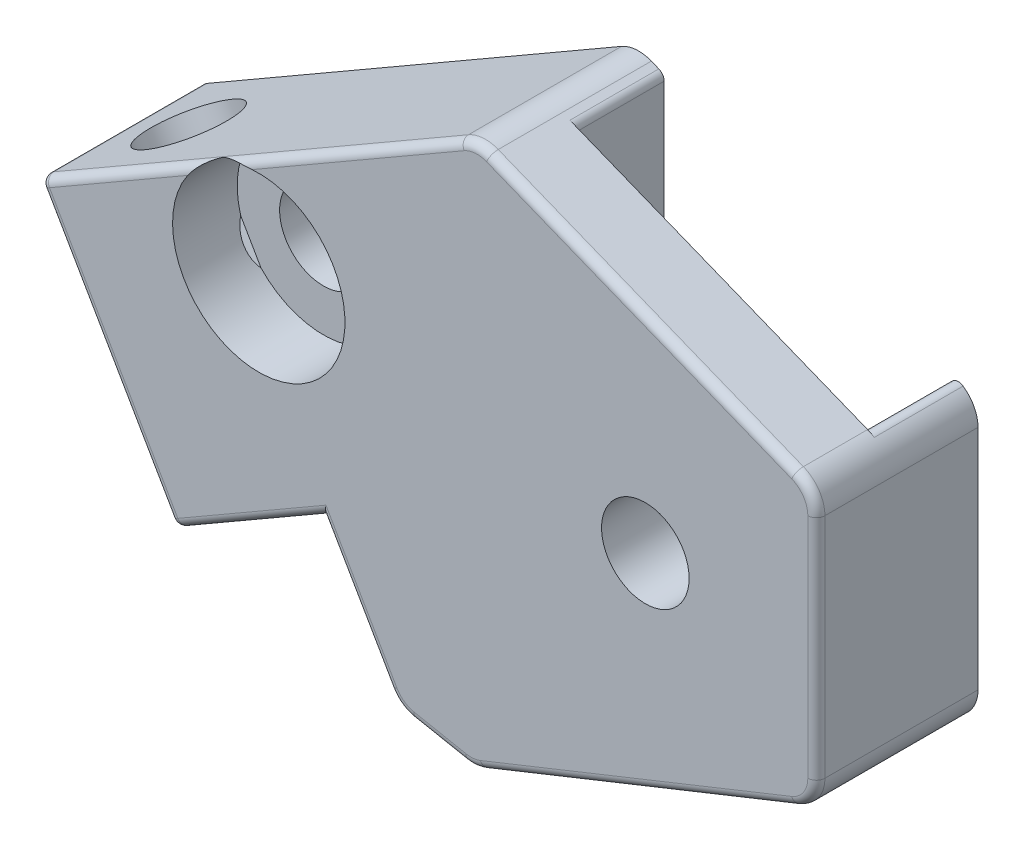
from build123d import *

# Parameters (mm, degrees)
SKETCH1_R           = 2.032
BOSS_EXTRUDE1_DEPTH = 3.375
BOSS_EXTRUDE2_DEPTH = 4.125
SKETCH4_R           = 2.032
BOSS_EXTRUDE3_DEPTH = 7.5
SKETCH5_R           = 2.032
CUT_EXTRUDE1_DEPTH  = 36.913493423
SKETCH6_W           = 7.9375
SKETCH6_H           = 7.5
CUT_EXTRUDE2_DEPTH  = 34.905049671
FILLET1_R           = 1.5875
FILLET2_R           = 0.396875
SKETCH7_R           = 4
CUT_EXTRUDE3_DEPTH  = 3


with BuildPart() as part:
    # Sketch1 → Boss-Extrude1 (new body)
    with BuildSketch(Plane.XY):
        Polygon((5.291666667, -6.35), (-10.583333333, -12.7), (-10.583333333, 12.7), (5.291666667, 6.35), align=None)
        with Locations((-2.645833333, 0)):
            Circle(SKETCH1_R, mode=Mode.SUBTRACT)
    extrude(amount=BOSS_EXTRUDE1_DEPTH)

    # Sketch2 → Boss-Extrude2 (add)
    with BuildSketch(Plane.XY.offset(3.375)):
        Polygon((-10.583333333, 12.7), (-10.583333333, -12.7), (-9.270833333, -12.175), (-9.270833333, 12.175), align=None)
        Polygon((5.291666667, 6.35), (5.291666667, -6.35), (3.979166667, -6.875), (3.979166667, 6.875), align=None)
    extrude(amount=BOSS_EXTRUDE2_DEPTH)

    # Sketch4 → Boss-Extrude3 (add)
    with BuildSketch(Plane(origin=(0, 0, 0), x_dir=(-1, 0, 0), z_dir=(0, 0, -1))):
        Polygon((10.583333333, 12.7), (30.835957968, 1.007141715), (24.485957968, -9.991380913), (10.583333333, -12.7), align=None)
        with Locations((20.584583333, 2.30124)):
            Circle(SKETCH4_R, mode=Mode.SUBTRACT)
    extrude(amount=-BOSS_EXTRUDE3_DEPTH)

    # Sketch5 → Cut-Extrude1 (cut, through all)
    with BuildSketch(Plane(origin=(-8.145094647, 14.107717762, 0), x_dir=(0.8660254037844418, 0.49999999999999467, 0), z_dir=(-0.49999999999999467, 0.8660254037844418, 0))):
        with Locations(Location((-22.451152093, -3.75, 0), (0, 0, 180))):
            Circle(SKETCH5_R)
    extrude(amount=-CUT_EXTRUDE1_DEPTH, mode=Mode.SUBTRACT)

    # Sketch6 → Cut-Extrude2 (cut, through all)
    with BuildSketch(Plane(origin=(-1.795094647, 3.109195134, 0), x_dir=(0.8660254037844418, 0.49999999999999467, 0), z_dir=(-0.49999999999999467, 0.8660254037844418, 0))):
        with Locations((-22.232402093, -3.75)):
            Rectangle(SKETCH6_W, SKETCH6_H)
    extrude(amount=-CUT_EXTRUDE2_DEPTH, mode=Mode.SUBTRACT)

    # Fillet1
    fillet1_edges = [part.edges().sort_by_distance(p)[0] for p in [
        (-14.158893581, -12.003381125, 3.75),
        (-10.583333333, 12.7, 3.75),
        (5.291666667, 6.35, 3.75),
        (5.291666667, -6.35, 3.75),
        (-10.583333333, -12.7, 3.75),
    ]]
    fillet(fillet1_edges, radius=FILLET1_R)

    # Fillet2
    # the kernel refuses this fillet: 0.396875 mm, written as the material it takes off along each edge
    with BuildSketch(Plane(origin=(-30.293816636, 0.861875383, 0.396875), x_dir=(-0.49999999999999467, 0.8660254037844418, 0), z_dir=(0, 0, -1))) as fillet2_piece_1_section:
        Polygon((0, 0), (FILLET2_R, 0), (FILLET2_R, -FILLET2_R), (0, -FILLET2_R), align=None)
    fillet2_piece_1 = extrude(amount=FILLET2_R, mode=Mode.PRIVATE)
    fillet2_piece_1 = fillet2_piece_1 - Plane(origin=(-30.293816636, 0.861875383, 0.396875), x_dir=(0.9659258262890668, -0.25881904510252635, 0), z_dir=(0, 0, -1)) * Sphere(FILLET2_R, mode=Mode.PRIVATE)
    add(fillet2_piece_1, mode=Mode.SUBTRACT)
    with BuildSketch(Plane(origin=(-24.340691636, -9.449239581, 0.396875), x_dir=(0, 0, -1), z_dir=(0.49999999999999467, -0.8660254037844418, 0))) as fillet2_piece_2_section:
        Polygon((0, 0), (FILLET2_R, 0), (FILLET2_R, -FILLET2_R), (0, -FILLET2_R), align=None)
    fillet2_piece_2 = extrude(amount=FILLET2_R, mode=Mode.PRIVATE)
    fillet2_piece_2 = fillet2_piece_2 - Plane(origin=(-24.340691636, -9.449239581, 0.396875), x_dir=(0.6123724356957964, 0.35355339059327046, 0.7071067811865475), z_dir=(0.49999999999999467, -0.8660254037844418, 0)) * Sphere(FILLET2_R, mode=Mode.PRIVATE)
    add(fillet2_piece_2, mode=Mode.SUBTRACT)
    with BuildSketch(Plane(origin=(-9.270833333, 12.175, 3.375), x_dir=(0, -1, 0), z_dir=(0, 0, 1)), Plane(origin=(-9.270833333, -12.175, 3.375), x_dir=(-0.9284766908852634, -0.37139067635409345, 0), z_dir=(0, 0, 1))) as fillet2_piece_3:
        with BuildLine():
            CenterArc((FILLET2_R * 0.677032961427, -FILLET2_R), FILLET2_R, 90, 68.198590514)
            Line((-FILLET2_R * 0.251443729458, -FILLET2_R * 0.628609323646), (0, 0))
            Line((0, 0), (FILLET2_R * 0.677032961427, 0))
        make_face()
    extrude(amount=4.796743641, mode=Mode.SUBTRACT)
    with BuildSketch(Plane(origin=(3.979166667, 6.875, 3.375), x_dir=(0, -1, 0), z_dir=(0, 0, 1))) as fillet2_piece_4:
        with BuildLine():
            CenterArc((0.616849403, 0.396875), FILLET2_R, 145.645994163, 124.354005837)
            Line((0.289202596, 0.620833333), (0.256437915, 0.643229167))
            ThreePointArc((0.256437915, 0.643229167), (0.088984161, 0.329322266), (-0.036848919, 0.014739567))
            Line((-0.036848919, 0.014739567), (0, -0.0396875))
            Line((0, -0.0396875), (0.616849403, -0.0396875))
            Line((0.616849403, -0.0396875), (0.616849403, 0))
        make_face()
    extrude(amount=5.837221089, mode=Mode.SUBTRACT)
    with BuildSketch(Plane(origin=(3.979166667, -6.875, 3.375), x_dir=(0.9064736694503883, 0.4222623433283487, 0), z_dir=(0, 0, 1))) as fillet2_piece_5:
        with BuildLine():
            CenterArc((0.620229012, 0.391572375), FILLET2_R, 155.022498711, 124.354005837)
            Line((0.260472275, 0.559157742), (0.224496601, 0.575916279))
            Line((0.224496601, 0.575916279), (-0.035975674, 0.016758537))
            Line((-0.035975674, 0.016758537), (-0.002198881, -0.039626539))
            ThreePointArc((-0.002198881, -0.039626539), (0.336096623, -0.058398593), (0.691354378, -0.039157237))
            Line((0.691354378, -0.039157237), (0.684888436, 0))
        make_face()
    extrude(amount=5.837221089, mode=Mode.SUBTRACT)
    with BuildSketch(Plane(origin=(-30.835957968, 1.007141715, 0.396875), x_dir=(0.866025403784441, 0.4999999999999959, 0), z_dir=(0, 0, 1)), Plane(origin=(-24.485957968, -9.991380913, 0.396875), x_dir=(-0.4999999999999916, 0.8660254037844436, 0), z_dir=(0, 0, 1))) as fillet2_piece_6:
        with BuildLine():
            CenterArc((FILLET2_R, -FILLET2_R), FILLET2_R, 90, 90)
            Line((0, -FILLET2_R), (0, 0))
            Line((0, 0), (FILLET2_R, 0))
        make_face()
    extrude(amount=8.0953125, mode=Mode.SUBTRACT)
    with BuildSketch(Plane(origin=(-30.637520468, 0.663437883, 0), x_dir=(0.8660254037844414, 0.4999999999999952, 0), z_dir=(0.49999999999999534, -0.8660254037844414, 0))) as fillet2_piece_7:
        with BuildLine():
            CenterArc((FILLET2_R, FILLET2_R), FILLET2_R, 180, 90)
            Line((0, FILLET2_R), (0, 0))
            Line((0, 0), (FILLET2_R, 0))
        make_face()
    extrude(amount=11.90625, mode=Mode.SUBTRACT)
    with BuildSketch(Plane(origin=(-11.250928686, 12.314563643, 0), x_dir=(0.49999999999999467, -0.8660254037844418, 0), z_dir=(-0.8660254037844418, -0.49999999999999467, 0))) as fillet2_piece_8:
        with BuildLine():
            CenterArc((FILLET2_R, FILLET2_R), FILLET2_R, 180, 90)
            Line((0, FILLET2_R), (0, 0))
            Line((0, 0), (FILLET2_R, 0))
        make_face()
    extrude(amount=22.217968856, mode=Mode.SUBTRACT)
    with BuildSketch(Plane(origin=(-17.611881326, -6.022630913, 0), x_dir=(-0.49999999999999467, 0.8660254037844418, 0), z_dir=(-0.8660254037844418, -0.49999999999999467, 0))) as fillet2_piece_9:
        with BuildLine():
            CenterArc((FILLET2_R, -FILLET2_R), FILLET2_R, 90, 90)
            Line((0, -FILLET2_R), (0, 0))
            Line((0, 0), (FILLET2_R, 0))
        make_face()
    extrude(amount=7.540625, mode=Mode.SUBTRACT)
    with BuildSketch(Plane(origin=(-17.611881326, -6.022630913, 0), x_dir=(0.8660254037844417, 0.49999999999999467, 0), z_dir=(0.4999999999999947, -0.8660254037844418, 0))) as fillet2_piece_10:
        with BuildLine():
            CenterArc((FILLET2_R, FILLET2_R), FILLET2_R, 180, 90)
            Line((0, FILLET2_R), (0, 0))
            Line((0, 0), (FILLET2_R, 0))
        make_face()
    extrude(amount=6.182923419, mode=Mode.SUBTRACT)
    with BuildSketch(Plane(origin=(-13.449185577, -12.141652041, 0), x_dir=(0.19123230784154585, 0.9815448051095764, 0), z_dir=(0.9815448051095764, -0.19123230784154585, 0))) as fillet2_piece_11:
        with BuildLine():
            CenterArc((FILLET2_R, FILLET2_R), FILLET2_R, 180, 90)
            Line((0, FILLET2_R), (0, 0))
            Line((0, 0), (FILLET2_R, 0))
        make_face()
    extrude(amount=2.452116689, mode=Mode.SUBTRACT)
    with BuildSketch(Plane(origin=(-9.867595987, 12.413705062, 0), x_dir=(-0.37139067635410367, -0.9284766908852593, 0), z_dir=(0.9284766908852594, -0.3713906763541037, 0))) as fillet2_piece_12:
        with BuildLine():
            CenterArc((FILLET2_R, -FILLET2_R), FILLET2_R, 90, 90)
            Line((0, -FILLET2_R), (0, 0))
            Line((0, 0), (FILLET2_R, 0))
        make_face()
    extrude(amount=15.252235723, mode=Mode.SUBTRACT)
    with BuildSketch(Plane(origin=(5.291666667, 5.275210174, 0), x_dir=(-1, 0, 0), z_dir=(0, -1, 0))) as fillet2_piece_13:
        with BuildLine():
            CenterArc((FILLET2_R, -FILLET2_R), FILLET2_R, 90, 90)
            Line((0, -FILLET2_R), (0, 0))
            Line((0, 0), (FILLET2_R, 0))
        make_face()
    extrude(amount=10.550420347, mode=Mode.SUBTRACT)
    with BuildSketch(Plane(origin=(4.293749365, -6.749166921, 0), x_dir=(0, 0, 1), z_dir=(-0.9284766908852594, -0.3713906763541037, 0))) as fillet2_piece_14:
        with BuildLine():
            CenterArc((FILLET2_R, FILLET2_R), FILLET2_R, 180, 90)
            Line((0, FILLET2_R), (0, 0))
            Line((0, 0), (FILLET2_R, 0))
        make_face()
    extrude(amount=15.555488575, mode=Mode.SUBTRACT)
    with BuildSketch(Plane(origin=(-10.73874189, -11.052373597, 0), x_dir=(0.37139067635410195, -0.92847669088526, 0), z_dir=(0.92847669088526, 0.37139067635410195, 0))) as fillet2_piece_15:
        with BuildLine():
            CenterArc((1.5875 - FILLET2_R, -FILLET2_R), FILLET2_R, 0, 90)
            Line((1.5875, -FILLET2_R), (1.5875, 0))
            Line((1.5875, 0), (1.5875 - FILLET2_R, 0))
        make_face()
    revolve(axis=Axis((-10.73874189, -11.052373597, 0), (0, 0, -1)), revolution_arc=32.826118495, mode=Mode.SUBTRACT)
    with BuildSketch(Plane(origin=(3.704166667, 5.275210174, 0), x_dir=(1, 0, 0), z_dir=(0, -1, 0))) as fillet2_piece_16:
        with BuildLine():
            CenterArc((1.5875 - FILLET2_R, FILLET2_R), FILLET2_R, 270, 90)
            Line((1.5875, FILLET2_R), (1.5875, 0))
            Line((1.5875, 0), (1.5875 - FILLET2_R, 0))
        make_face()
    revolve(axis=Axis((3.704166667, 5.275210174, 0), (0, 0, 1)), revolution_arc=68.198590514, mode=Mode.SUBTRACT)
    with BuildSketch(Plane(origin=(3.704166667, -5.275210174, 0), x_dir=(0.37139067635410355, -0.9284766908852593, 0), z_dir=(-0.9284766908852593, -0.37139067635410355, 0))) as fillet2_piece_17:
        with BuildLine():
            CenterArc((1.5875 - FILLET2_R, FILLET2_R), FILLET2_R, 270, 90)
            Line((1.5875 - FILLET2_R, 0), (1.5875, 0))
            Line((1.5875, 0), (1.5875, FILLET2_R))
        make_face()
    revolve(axis=Axis((3.704166667, -5.275210174, 0), (0, 0, 1)), revolution_arc=68.198590514, mode=Mode.SUBTRACT)
    with BuildSketch(Plane(origin=(-10.457178686, 10.939748315, 0), x_dir=(0.37139067635410433, 0.9284766908852591, 0), z_dir=(0.9284766908852591, -0.37139067635410433, 0))) as fillet2_piece_18:
        with BuildLine():
            CenterArc((1.5875 - FILLET2_R, FILLET2_R), FILLET2_R, 270, 90)
            Line((1.5875, FILLET2_R), (1.5875, 0))
            Line((1.5875, 0), (1.5875 - FILLET2_R, 0))
        make_face()
    revolve(axis=Axis((-10.457178686, 10.939748315, 0), (0, 0, 1)), revolution_arc=51.801409486, mode=Mode.SUBTRACT)
    with BuildSketch(Plane(origin=(-13.145604288, -10.583449663, 0), x_dir=(-0.19123230784154518, -0.9815448051095765, 0), z_dir=(0.9815448051095765, -0.19123230784154518, 0))) as fillet2_piece_19:
        with BuildLine():
            CenterArc((1.5875 - FILLET2_R, -FILLET2_R), FILLET2_R, 0, 90)
            Line((1.5875, -FILLET2_R), (1.5875, 0))
            Line((1.5875, 0), (1.5875 - FILLET2_R, 0))
        make_face()
    revolve(axis=Axis((-13.145604288, -10.583449663, 0), (0, 0, -1)), revolution_arc=48.975290991, mode=Mode.SUBTRACT)
    with BuildSketch(Plane(origin=(-16.752621745, -5.526537163, 0), x_dir=(-0.49999999999999467, 0.8660254037844418, 0), z_dir=(-0.8660254037844418, -0.49999999999999467, 0))) as fillet2_piece_20a_section:
        with BuildLine():
            CenterArc((FILLET2_R, -FILLET2_R), FILLET2_R, 90, 90)
            Line((0, -FILLET2_R), (0, 0))
            Line((0, 0), (FILLET2_R, 0))
        make_face()
    fillet2_piece_20a = extrude(amount=8.5328125, mode=Mode.PRIVATE)
    fillet2_piece_20a = split(fillet2_piece_20a, bisect_by=Plane(origin=(-17.656806606, -5.944818045, 0.089850561), z_dir=(0.8660254037844418, 0.4999999999999947, 0)), keep=Keep.TOP, mode=Mode.PRIVATE)
    with BuildSketch(Plane(origin=(-18.107975076, -5.163371333, 0), x_dir=(0.8660254037844417, 0.49999999999999467, 0), z_dir=(0.4999999999999947, -0.8660254037844418, 0))) as fillet2_piece_20b_section:
        with BuildLine():
            CenterArc((FILLET2_R, FILLET2_R), FILLET2_R, 180, 90)
            Line((0, FILLET2_R), (0, 0))
            Line((0, 0), (FILLET2_R, 0))
        make_face()
    fillet2_piece_20b = extrude(amount=7.175110919, mode=Mode.PRIVATE)
    fillet2_piece_20b = split(fillet2_piece_20b, bisect_by=Plane(origin=(-17.534068457, -5.977705632, 0.089850561), z_dir=(-0.49999999999999467, 0.8660254037844418, 0)), keep=Keep.TOP, mode=Mode.PRIVATE)
    fillet2_piece_20 = fillet2_piece_20a & fillet2_piece_20b
    add(fillet2_piece_20, mode=Mode.SUBTRACT)


with BuildPart() as body_2:
    # Mirror1: mirrored copy
    add(part.part.mirror(Plane.XY.offset(7.5)))

    # Sketch7 → Cut-Extrude3 (cut)
    with BuildSketch(Plane.XY.offset(15)):
        with Locations(Location((-20.584583333, 2.30124, 0), (0, 0, 94.425213479))):
            Circle(SKETCH7_R)
    extrude(amount=-CUT_EXTRUDE3_DEPTH, mode=Mode.SUBTRACT)


solid = body_2.part
